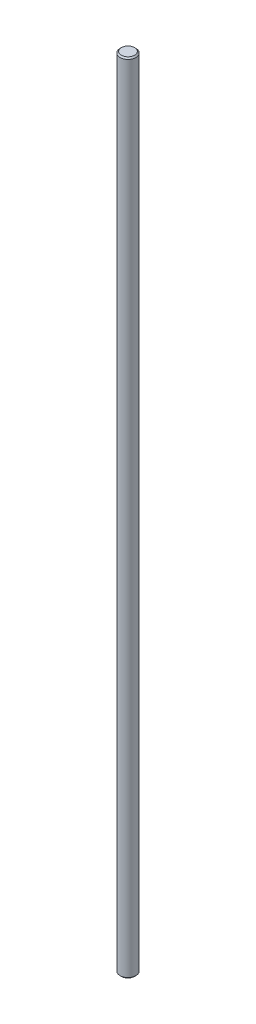
from build123d import *

# Parameters (mm, degrees)
SKETCH1_R           = 3
BOSS_EXTRUDE1_DEPTH = 301
CHAMFER1_SIZE       = 0.5
CHAMFER2_SIZE       = 0.5


with BuildPart() as part:
    # Sketch1 → Boss-Extrude1 (new body)
    with BuildSketch(Plane(origin=(0, 0, 0), x_dir=(1, 0, 0), z_dir=(0, 1, 0))):
        Circle(SKETCH1_R)
    extrude(amount=BOSS_EXTRUDE1_DEPTH)

    # Chamfer1
    chamfer1_edges = [part.edges().sort_by_distance(p)[0] for p in [
        (-3, 0, 0),
    ]]
    chamfer(chamfer1_edges, length=CHAMFER1_SIZE)

    # Chamfer2
    chamfer2_edges = [part.edges().sort_by_distance(p)[0] for p in [
        (-3, 301, 0),
    ]]
    chamfer(chamfer2_edges, length=CHAMFER2_SIZE)


solid = part.part
